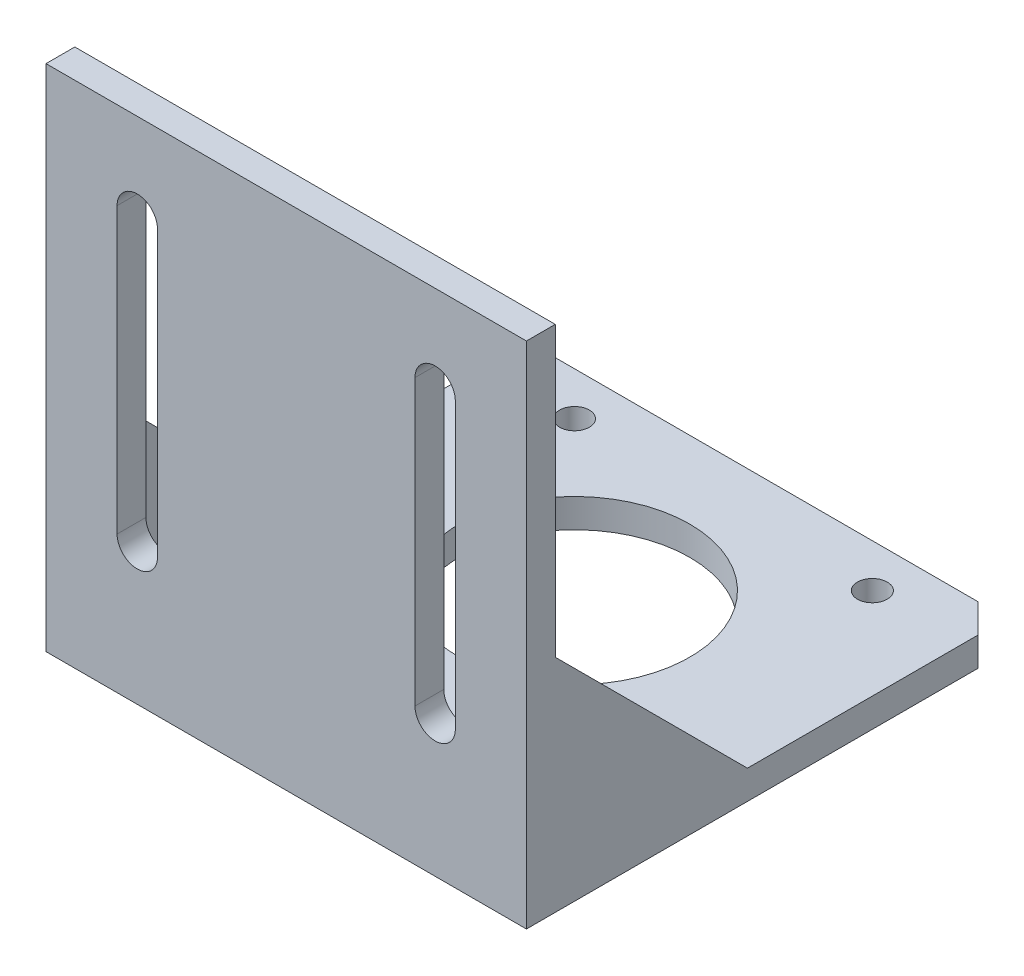
from build123d import *

# Parameters (mm, degrees)
BASESKETCH1_R             = 12
BASESKETCH1_R_2           = 1.55
WIDTHBOSS_EXTRUDE1_DEPTH  = 3
SKETCH2_W                 = 50
SKETCH2_H                 = 3
HEIGHTBOSS_EXTRUDE2_DEPTH = 50
SLOTSCUT_EXTRUDE1_DEPTH   = 87.706401148
WEDGESKETCH4_W            = 3
WEDGESKETCH4_H            = 20
ANGLEBOSS_EXTRUDE3_DEPTH  = 20
CHAMFER1_SIZE             = 20


with BuildPart() as part:
    # BaseSketch1 → WidthBoss-Extrude1 (new body)
    with BuildSketch(Plane(origin=(0, 0, 0), x_dir=(1, 0, 0), z_dir=(0, 1, 0))):
        Polygon((0, 0), (50, 0), (50, 46.99479618), (46.99479618, 50), (3.00520382, 50), (0, 46.99479618), align=None)
        with Locations(Location((25, 30, 0), (0, 0, 270))):
            Circle(BASESKETCH1_R, mode=Mode.SUBTRACT)
        with Locations(Location((9.5, 45.5, 0), (0, 0, 270))):
            Circle(BASESKETCH1_R_2, mode=Mode.SUBTRACT)
        with Locations(Location((40.5, 45.5, 0), (0, 0, 270))):
            Circle(BASESKETCH1_R_2, mode=Mode.SUBTRACT)
        with Locations(Location((40.5, 14.5, 0), (0, 0, 270))):
            Circle(BASESKETCH1_R_2, mode=Mode.SUBTRACT)
        with Locations(Location((9.5, 14.5, 0), (0, 0, 270))):
            Circle(BASESKETCH1_R_2, mode=Mode.SUBTRACT)
    extrude(amount=WIDTHBOSS_EXTRUDE1_DEPTH)

    # Sketch2 → HeightBoss-Extrude2 (add)
    with BuildSketch(Plane(origin=(0, 3, 0), x_dir=(1, 0, 0), z_dir=(0, 1, 0))):
        with Locations((25, 1.5)):
            Rectangle(SKETCH2_W, SKETCH2_H)
    extrude(amount=HEIGHTBOSS_EXTRUDE2_DEPTH)

    # Sketch3 → SlotsCut-Extrude1 (cut, through all)
    with BuildSketch(Plane(origin=(0, 0, -3), x_dir=(-1, 0, 0), z_dir=(0, 0, -1))):
        with BuildLine():
            Line((-42.6, 14.3), (-42.6, 43.9))
            ThreePointArc((-42.6, 43.9), (-40.5, 46), (-38.4, 43.9))
            Line((-38.4, 43.9), (-38.4, 14.3))
            ThreePointArc((-38.4, 14.3), (-40.5, 12.2), (-42.6, 14.3))
        make_face()
        with BuildLine():
            Line((-11.6, 14.3), (-11.6, 43.9))
            ThreePointArc((-11.6, 43.9), (-9.5, 46), (-7.4, 43.9))
            Line((-7.4, 43.9), (-7.4, 14.3))
            ThreePointArc((-7.4, 14.3), (-9.5, 12.2), (-11.6, 14.3))
        make_face()
    extrude(amount=-SLOTSCUT_EXTRUDE1_DEPTH, mode=Mode.SUBTRACT)

    # WedgeSketch4 → AngleBoss-Extrude3 (add)
    with BuildSketch(Plane(origin=(0, 3, 0), x_dir=(1, 0, 0), z_dir=(0, 1, 0))):
        with Locations((48.5, 13)):
            Rectangle(WEDGESKETCH4_W, WEDGESKETCH4_H)
        with Locations((1.5, 13)):
            Rectangle(WEDGESKETCH4_W, WEDGESKETCH4_H)
    extrude(amount=ANGLEBOSS_EXTRUDE3_DEPTH)

    # Chamfer1
    chamfer1_edges = [part.edges().sort_by_distance(p)[0] for p in [
        (48.5, 23, -23),
        (1.5, 23, -23),
    ]]
    chamfer(chamfer1_edges, length=CHAMFER1_SIZE - 0.0001)  # a hair under: the kernel refuses the full size


solid = part.part
